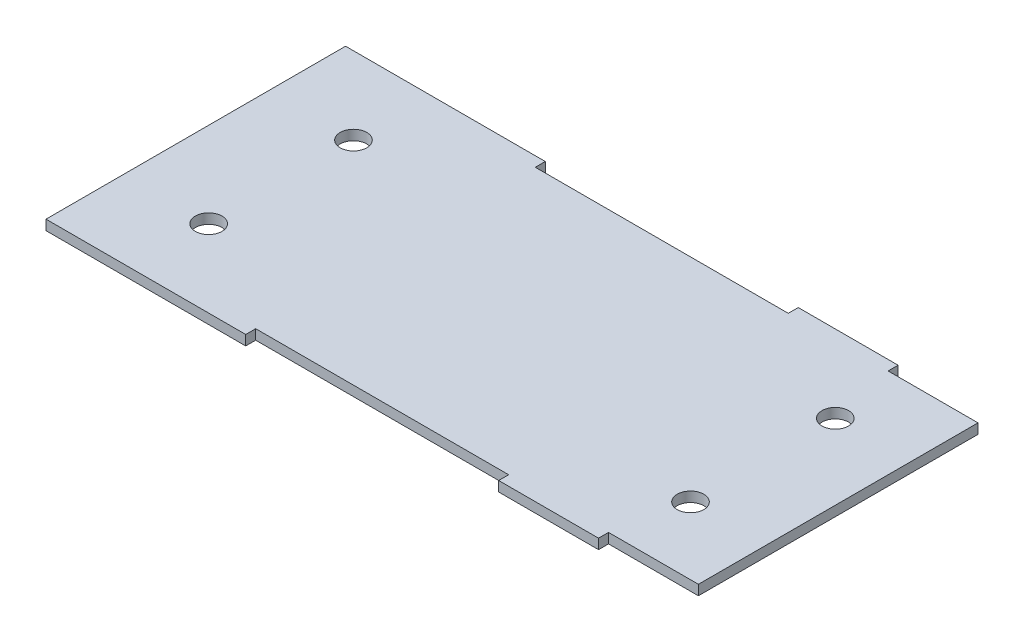
from build123d import *

# Parameters (mm, degrees)
SKETCH1_R           = 4
BOSS_EXTRUDE1_DEPTH = 3


with BuildPart() as part:
    # Sketch1 → Boss-Extrude1 (new body)
    with BuildSketch(Plane(origin=(0, 0, 0), x_dir=(1, 0, 0), z_dir=(0, 1, 0))):
        Polygon((68, 45), (38, 45), (38, 42), (-38, 42), (-38, 45), (-98, 45), (-98, -45), (-38, -45), (-38, -42), (38, -42), (38, -45), (68, -45), (68, -42), (95, -42), (95, 42), (68, 42), align=None)
        with Locations((-72.375, -21.75)):
            Circle(SKETCH1_R, mode=Mode.SUBTRACT)
        with Locations((72.375, -21.75)):
            Circle(SKETCH1_R, mode=Mode.SUBTRACT)
        with Locations((-72.375, 21.75)):
            Circle(SKETCH1_R, mode=Mode.SUBTRACT)
        with Locations((72.375, 21.75)):
            Circle(SKETCH1_R, mode=Mode.SUBTRACT)
    extrude(amount=BOSS_EXTRUDE1_DEPTH)


solid = part.part
